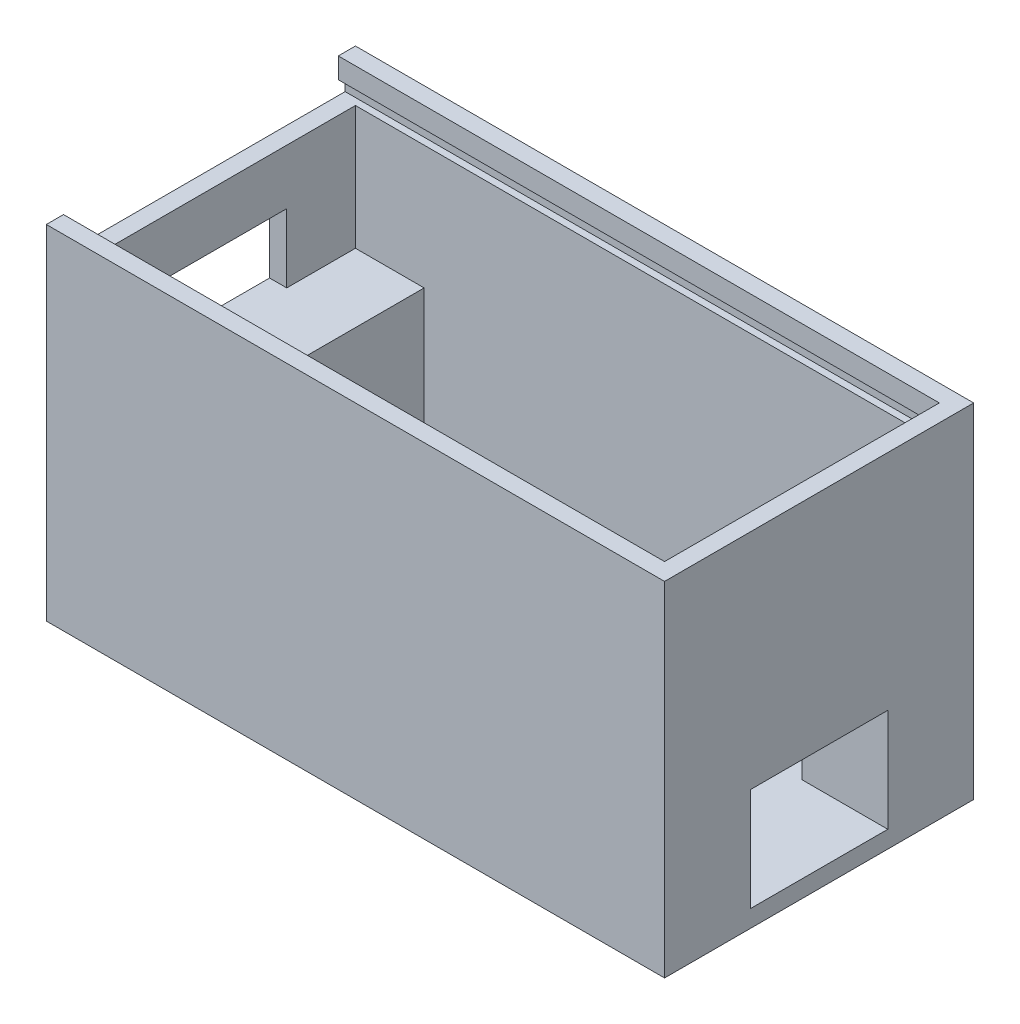
from build123d import *

# Parameters (mm, degrees)
SKETCH1_W           = 90
SKETCH1_H           = 45
BOSS_EXTRUDE1_DEPTH = 50
SHELL1_T            = -2.5
SKETCH2_W           = 40
SKETCH2_H           = 24.5
BOSS_EXTRUDE2_DEPTH = 10
SKETCH3_W           = 40
SKETCH3_H           = 19.5
BOSS_EXTRUDE3_DEPTH = 10
SKETCH9_W           = 20
SKETCH9_H           = 10
CUT_EXTRUDE3_DEPTH  = 2.5
SKETCH11_W          = 20
SKETCH11_H          = 15
CUT_EXTRUDE5_DEPTH  = 12.5
SKETCH13_W          = 40
SKETCH13_H          = 5
CUT_EXTRUDE6_DEPTH  = 2.5
SKETCH14_W          = 87.5
SKETCH14_H          = 2
CUT_EXTRUDE7_DEPTH  = 1
SKETCH15_W          = 87.5
SKETCH15_H          = 2
CUT_EXTRUDE8_DEPTH  = 1


with BuildPart() as part:
    # Sketch1 → Boss-Extrude1 (new body)
    with BuildSketch(Plane(origin=(0, 0, 0), x_dir=(1, 0, 0), z_dir=(0, 1, 0))):
        with Locations((4.862356655, 3.4550978)):
            Rectangle(SKETCH1_W, SKETCH1_H)
    extrude(amount=BOSS_EXTRUDE1_DEPTH)

    # Shell1
    shell1_openings = [part.faces().sort_by_distance(p)[0] for p in [
        (4.862356655, 50, -3.4550978),
    ]]
    offset(amount=SHELL1_T, openings=shell1_openings, kind=Kind.INTERSECTION)

    # Sketch2 → Boss-Extrude2 (add)
    with BuildSketch(Plane(origin=(-37.637643345, 0, 0), x_dir=(0, 0, -1), z_dir=(1, 0, 0))):
        with Locations((3.4550978, 14.75)):
            Rectangle(SKETCH2_W, SKETCH2_H)
    extrude(amount=BOSS_EXTRUDE2_DEPTH)

    # Sketch3 → Boss-Extrude3 (add)
    with BuildSketch(Plane.ZY.offset(-47.362356655)):
        with Locations((-3.4550978, 12.25)):
            Rectangle(SKETCH3_W, SKETCH3_H)
    extrude(amount=BOSS_EXTRUDE3_DEPTH)

    # Sketch9 → Cut-Extrude3 (cut)
    with BuildSketch(Plane(origin=(-37.637643345, 0, 0), x_dir=(0, 0, -1), z_dir=(1, 0, 0))):
        with Locations((3.4550978, 32)):
            Rectangle(SKETCH9_W, SKETCH9_H)
    extrude(amount=-CUT_EXTRUDE3_DEPTH, mode=Mode.SUBTRACT)

    # Sketch11 → Cut-Extrude5 (cut)
    with BuildSketch(Plane.ZY.offset(-37.362356655)):
        with Locations((-3.4550978, 10)):
            Rectangle(SKETCH11_W, SKETCH11_H)
    extrude(amount=-CUT_EXTRUDE5_DEPTH, mode=Mode.SUBTRACT)

    # Sketch13 → Cut-Extrude6 (cut)
    with BuildSketch(Plane(origin=(-37.637643345, 0, 0), x_dir=(0, 0, -1), z_dir=(1, 0, 0))):
        with Locations((3.4550978, 47.5)):
            Rectangle(SKETCH13_W, SKETCH13_H)
    extrude(amount=-CUT_EXTRUDE6_DEPTH, mode=Mode.SUBTRACT)

    # Sketch14 → Cut-Extrude7 (cut)
    with BuildSketch(Plane.XY.offset(-23.4550978)):
        with Locations((3.612356655, 46)):
            Rectangle(SKETCH14_W, SKETCH14_H)
    extrude(amount=-CUT_EXTRUDE7_DEPTH, mode=Mode.SUBTRACT)

    # Sketch15 → Cut-Extrude8 (cut)
    with BuildSketch(Plane(origin=(0, 0, 16.5449022), x_dir=(-1, 0, 0), z_dir=(0, 0, -1))):
        with Locations((-3.612356655, 46)):
            Rectangle(SKETCH15_W, SKETCH15_H)
    extrude(amount=-CUT_EXTRUDE8_DEPTH, mode=Mode.SUBTRACT)


solid = part.part
